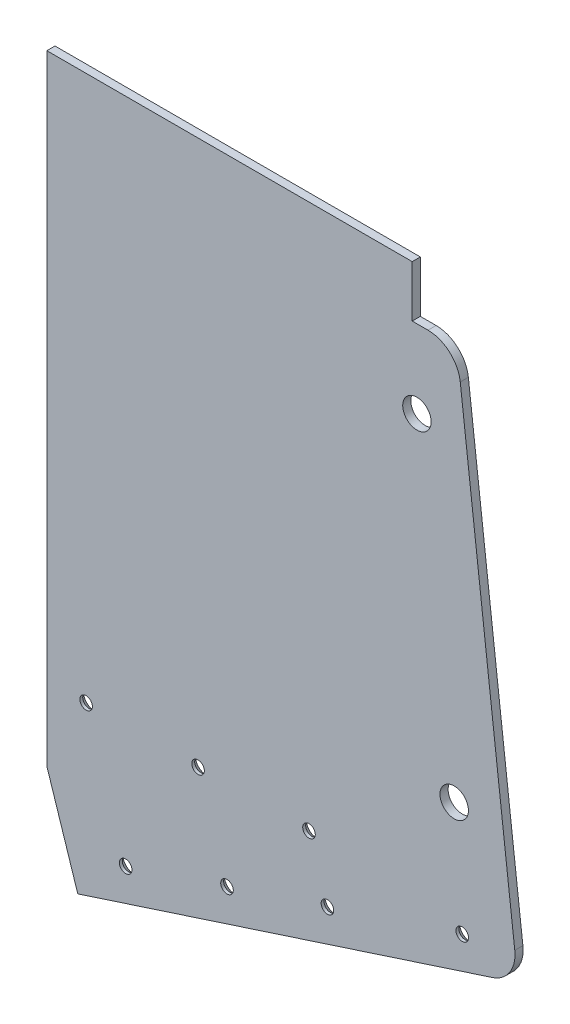
from build123d import *

# Parameters (mm, degrees)
BOSS_EXTRUDE1_DEPTH                           = 3.175
FILLET1_R                                     = 12.7
CUT_EXTRUDE1_DEPTH                            = 359.207230955
CSK_FOR_8_FLAT_HEAD_MACHINE_SCREW1_AT_2_COUNT = 2
CSK_FOR_8_FLAT_HEAD_MACHINE_SCREW1_AT_2_PITCH = 41.643335968
CSK_FOR_8_FLAT_HEAD_MACHINE_SCREW1_AT_3_COUNT = 2
CSK_FOR_8_FLAT_HEAD_MACHINE_SCREW1_AT_3_PITCH = 55.434622241
CSK_FOR_8_FLAT_HEAD_MACHINE_SCREW1_AT_4_COUNT = 2
CSK_FOR_8_FLAT_HEAD_MACHINE_SCREW1_AT_4_PITCH = 50.008853946
CSK_FOR_8_FLAT_HEAD_MACHINE_SCREW1_AT_5_COUNT = 2
CSK_FOR_8_FLAT_HEAD_MACHINE_SCREW1_AT_5_PITCH = 82.918335968
CSK_FOR_8_FLAT_HEAD_MACHINE_SCREW1_AT_6_COUNT = 2
CSK_FOR_8_FLAT_HEAD_MACHINE_SCREW1_AT_6_PITCH = 86.127052655
CSK_FOR_8_FLAT_HEAD_MACHINE_SCREW1_AT_7_COUNT = 2
CSK_FOR_8_FLAT_HEAD_MACHINE_SCREW1_AT_7_PITCH = 138.300491667
CUT_EXTRUDE2_REACH                            = 357.25
SKETCH5_R                                     = 5.55625


with BuildPart() as part:
    # Sketch1 → Boss-Extrude1 (new body)
    with BuildSketch(Plane.XY):
        Polygon((-234.752967181, 12.7), (-91.997327393, 12.7), (-91.997327393, -7.416979032), (-74.533465131, -7.416979032), (-50.700252483, -210.6746006), (-234.752967181, -270.542758328), align=None)
    extrude(amount=BOSS_EXTRUDE1_DEPTH)

    # Fillet1
    fillet1_edges = [part.edges().sort_by_distance(p)[0] for p in [
        (-74.533465131, -7.416979032, 1.5875),
        (-50.700252483, -210.6746006, 1.5875),
    ]]
    fillet(fillet1_edges, radius=FILLET1_R)

    # Sketch2 → Cut-Extrude1 (cut, through all)
    with BuildSketch(Plane.XY.offset(3.175)):
        Polygon((-234.752967181, -270.542758328), (-222.67581909, -266.614337017), (-234.752967181, -229.485553098), align=None)
    extrude(amount=-CUT_EXTRUDE1_DEPTH, mode=Mode.SUBTRACT)

    # Sketch4 → CSK for #8 Flat Head Machine Screw1 (revolve, cut)
    with BuildSketch(Plane(origin=(-203.96982343, -247.917009556, 0), x_dir=(0, 1, 0), z_dir=(1, 0, 0))):
        Polygon((0, 0), (0, 3.175), (2.45745, 3.175), (2.45745, 2.02344051), (4.2164, 0), align=None)
    csk_for_8_flat_head_machine_screw1 = revolve(axis=Axis((-203.96982343, -247.917009556, -6.35), (0, 0, 1)), mode=Mode.SUBTRACT)

    # CSK for #8 Flat Head Machine Screw1 at 2: CSK for #8 Flat Head Machine Screw1 ×2
    with Locations(*[Vector(0.9509565425677294, 0.30932451268470523, 0) * (i * CSK_FOR_8_FLAT_HEAD_MACHINE_SCREW1_AT_2_PITCH) for i in range(1, CSK_FOR_8_FLAT_HEAD_MACHINE_SCREW1_AT_2_COUNT)]):
        add(csk_for_8_flat_head_machine_screw1, mode=Mode.SUBTRACT)

    # CSK for #8 Flat Head Machine Screw1 at 3: CSK for #8 Flat Head Machine Screw1 ×2
    with Locations(*[Vector(0.5102012076622674, 0.8600550724808057, 0) * (i * CSK_FOR_8_FLAT_HEAD_MACHINE_SCREW1_AT_3_PITCH) for i in range(1, CSK_FOR_8_FLAT_HEAD_MACHINE_SCREW1_AT_3_COUNT)]):
        add(csk_for_8_flat_head_machine_screw1, mode=Mode.SUBTRACT)

    # CSK for #8 Flat Head Machine Screw1 at 4: CSK for #8 Flat Head Machine Screw1 ×2
    with Locations(*[Vector(-0.3093245126849687, 0.9509565425676436, 0) * (i * CSK_FOR_8_FLAT_HEAD_MACHINE_SCREW1_AT_4_PITCH) for i in range(1, CSK_FOR_8_FLAT_HEAD_MACHINE_SCREW1_AT_4_COUNT)]):
        add(csk_for_8_flat_head_machine_screw1, mode=Mode.SUBTRACT)

    # CSK for #8 Flat Head Machine Screw1 at 5: CSK for #8 Flat Head Machine Screw1 ×2
    with Locations(*[Vector(0.9509565425676433, 0.30932451268496985, 0) * (i * CSK_FOR_8_FLAT_HEAD_MACHINE_SCREW1_AT_5_PITCH) for i in range(1, CSK_FOR_8_FLAT_HEAD_MACHINE_SCREW1_AT_5_COUNT)]):
        add(csk_for_8_flat_head_machine_screw1, mode=Mode.SUBTRACT)

    # CSK for #8 Flat Head Machine Screw1 at 6: CSK for #8 Flat Head Machine Screw1 ×2
    with Locations(*[Vector(0.8318826599155766, 0.5549515655728751, 0) * (i * CSK_FOR_8_FLAT_HEAD_MACHINE_SCREW1_AT_6_PITCH) for i in range(1, CSK_FOR_8_FLAT_HEAD_MACHINE_SCREW1_AT_6_COUNT)]):
        add(csk_for_8_flat_head_machine_screw1, mode=Mode.SUBTRACT)

    # CSK for #8 Flat Head Machine Screw1 at 7: CSK for #8 Flat Head Machine Screw1 ×2
    with Locations(*[Vector(0.9509565425676433, 0.3093245126849699, 0) * (i * CSK_FOR_8_FLAT_HEAD_MACHINE_SCREW1_AT_7_PITCH) for i in range(1, CSK_FOR_8_FLAT_HEAD_MACHINE_SCREW1_AT_7_COUNT)]):
        add(csk_for_8_flat_head_machine_screw1, mode=Mode.SUBTRACT)

    # Sketch5 → Cut-Extrude2 (cut, up to next)
    with BuildSketch(Plane.XY.offset(3.175), mode=Mode.PRIVATE) as cut_extrude2_sk1:
        with Locations((-90.146601991, -37.840751583)):
            Circle(SKETCH5_R)
    cut_extrude2_tool1 = extrude(cut_extrude2_sk1.sketch, amount=-CUT_EXTRUDE2_REACH, mode=Mode.PRIVATE) & part.part
    # Sketch5 → Cut-Extrude2 (cut, up to next)
    with BuildSketch(Plane.XY.offset(3.175), mode=Mode.PRIVATE) as cut_extrude2_sk2:
        with Locations((-75.576674395, -162.097975039)):
            Circle(SKETCH5_R)
    cut_extrude2_tool2 = extrude(cut_extrude2_sk2.sketch, amount=-CUT_EXTRUDE2_REACH, mode=Mode.PRIVATE) & part.part
    add(cut_extrude2_tool1.solids().sort_by_distance((-90.146602, -37.840752, 3.175))[0], mode=Mode.SUBTRACT)
    add(cut_extrude2_tool2.solids().sort_by_distance((-75.576674, -162.097975, 3.175))[0], mode=Mode.SUBTRACT)


solid = part.part
